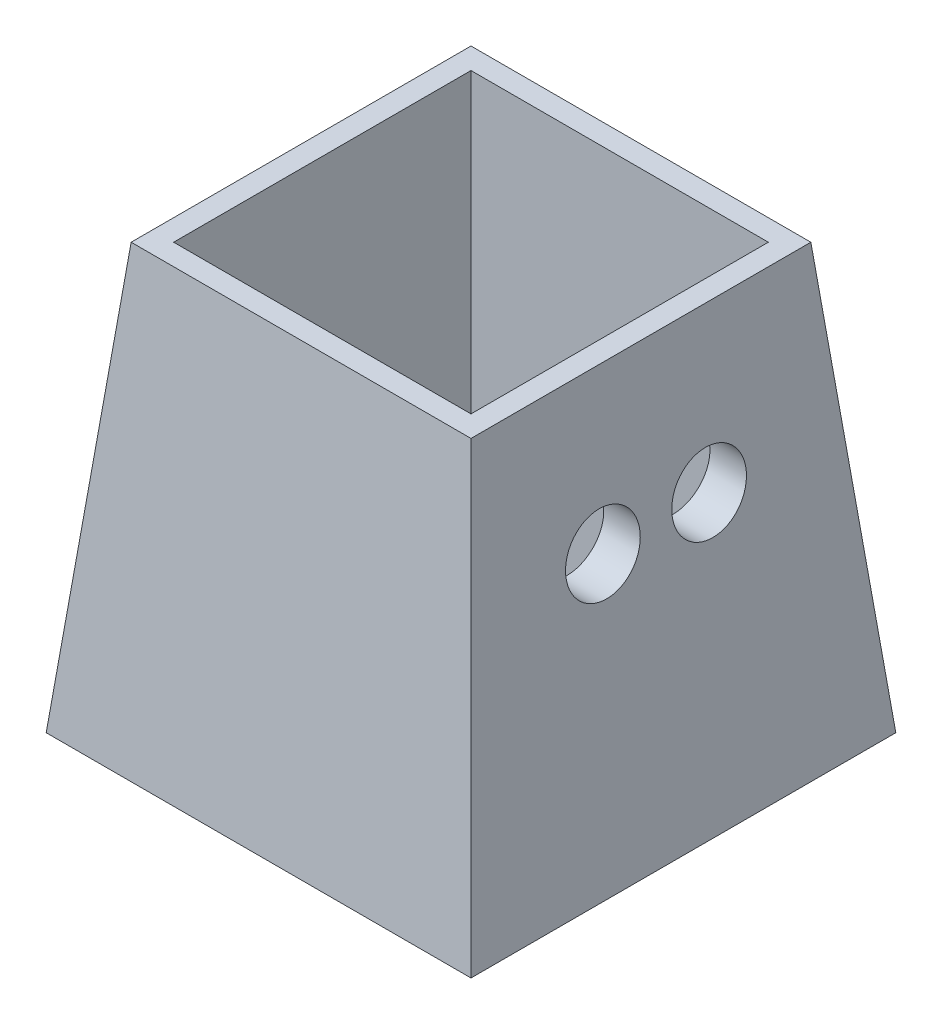
from build123d import *

# Parameters (mm, degrees)
ESBO_O1_W                = 100
ESBO_O1_H                = 100
RESSALTO_EXTRUS_O1_DEPTH = 100
CHANFRO1_START           = -50
CHANFRO1_DEPTH           = 100
CHANFRO1_START_2         = -51
CHANFRO1_2_DEPTH         = 102
ESBO_O3_W                = 70
ESBO_O3_H                = 25
CORTE_EXTRUS_O1_DEPTH    = 123.474487139
ESBO_O4_W                = 70
ESBO_O4_H                = 20
CORTE_EXTRUS_O2_DEPTH    = 90
ESBO_O8_R                = 8.75
CORTE_EXTRUS_O6_DEPTH    = 141.445719052


with BuildPart() as part:
    # Esboço1 → Ressalto-extrusão1 (new body)
    with BuildSketch(Plane(origin=(0, 0, 0), x_dir=(1, 0, 0), z_dir=(0, 1, 0))):
        Rectangle(ESBO_O1_W, ESBO_O1_H)
    extrude(amount=RESSALTO_EXTRUS_O1_DEPTH)

    # Chanfro1: read off the stored shape, not the designer's step
    # Chanfro1 outline → Chanfro1 (cut)
    with BuildSketch(Plane.XY.offset(CHANFRO1_START)):
        Polygon((-50, 0), (-40, 100), (-50, 100), align=None)
        Polygon((40, 100), (50, 0), (50, 100), align=None)
    extrude(amount=CHANFRO1_DEPTH, mode=Mode.SUBTRACT)

    # Chanfro1 2 outline → Chanfro1 2 (cut)
    with BuildSketch(Plane.YZ.offset(CHANFRO1_START_2)):
        Polygon((0, 50), (100, 40), (100, 50), align=None)
        Polygon((100, -40), (0, -50), (100, -50), align=None)
    extrude(amount=CHANFRO1_2_DEPTH, mode=Mode.SUBTRACT)

    # Esboço3 → Corte-extrusão1 (cut, through all)
    with BuildSketch(Plane(origin=(0, 100, 0), x_dir=(1, 0, 0), z_dir=(0, 1, 0))):
        with Locations((0, 22.5)):
            Rectangle(ESBO_O3_W, ESBO_O3_H)
        with Locations((0, -22.5)):
            Rectangle(ESBO_O3_W, ESBO_O3_H)
    extrude(amount=-CORTE_EXTRUS_O1_DEPTH, mode=Mode.SUBTRACT)

    # Esboço4 → Corte-extrusão2 (cut)
    with BuildSketch(Plane(origin=(0, 100, 0), x_dir=(1, 0, 0), z_dir=(0, 1, 0))):
        Rectangle(ESBO_O4_W, ESBO_O4_H)
    extrude(amount=-CORTE_EXTRUS_O2_DEPTH, mode=Mode.SUBTRACT)

    # Esboço8 → Corte-extrusão6 (cut, through all)
    with BuildSketch(Plane.ZY.offset(-35)):
        with Locations((12.5, 64.5)):
            Circle(ESBO_O8_R)
        with Locations((-12.5, 64.5)):
            Circle(ESBO_O8_R)
    extrude(amount=-CORTE_EXTRUS_O6_DEPTH, mode=Mode.SUBTRACT)


solid = part.part
